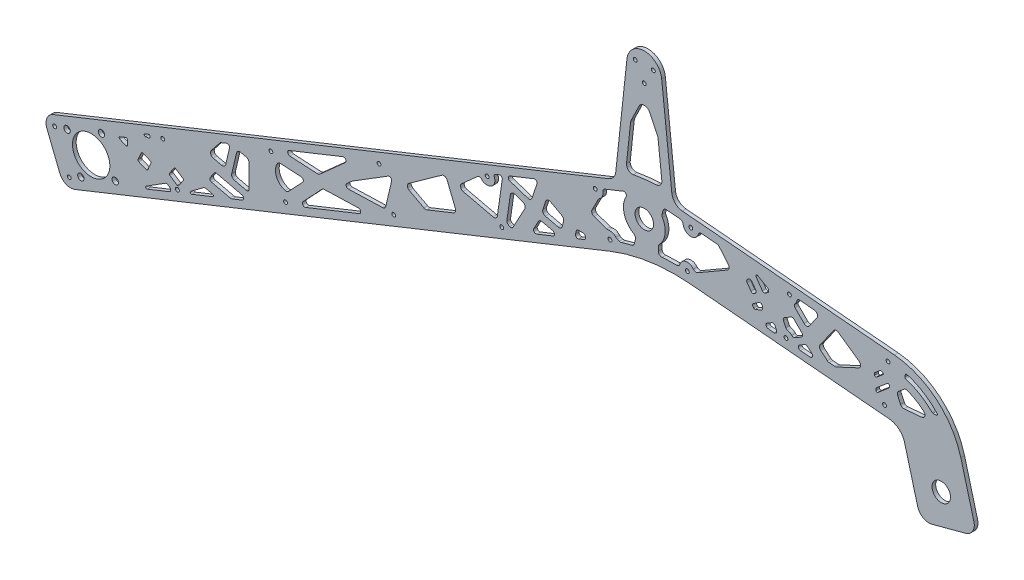
from build123d import *

# Parameters (mm, degrees)
SKETCH1_R                     = 7.9375
BASE_DEPTH                    = 3.175
FILLET1_R                     = 10
SKETCH2_R                     = 1.65
DIFFERENTIAL_ATTACHMENT_DEPTH = 561.184240235
SKETCH3_R                     = 1.65
STRUT_HOLES_DEPTH             = 561.184240235
LIGHTENING_HOLES_DEPTH        = 561.184240235
SKETCH4_R                     = 16.05
SKETCH4_R_2                   = 2.75
MOTOR_CONNECTION_DEPTH        = 561.184240235


with BuildPart() as part:
    # Sketch1 → Base (new body)
    with BuildSketch(Plane.XY):
        with BuildLine():
            Line((-25.142679348, 16.868752297), (-516.78145109, -179.7867564))
            Line((-516.78145109, -179.7867564), (-498.211917272, -226.210590945))
            Line((-498.211917272, -226.210590945), (-29.426356063, -38.696366461))
            ThreePointArc((-29.426356063, -38.696366461), (4.367965887, -29.577289686), (39.355606802, -28.53866538))
            Line((39.355606802, -28.53866538), (210.331723225, -43.497137301))
            ThreePointArc((210.331723225, -43.497137301), (218.666201229, -46.949391125), (223.513274478, -54.557772095))
            Line((223.513274478, -54.557772095), (237.32233047, -106.093870663))
            Line((237.32233047, -106.093870663), (285.618621785, -93.152918408))
            Line((285.618621785, -93.152918408), (271.809565792, -41.61681984))
            ThreePointArc((271.809565792, -41.61681984), (250.805581713, -8.647168969), (214.689510362, 6.312597604))
            Line((214.689510362, 6.312597604), (24.485725965, 22.953272498))
            Line((24.485725965, 22.953272498), (14.913323643, 111.610210516))
            ThreePointArc((14.913323643, 111.610210516), (0, 125), (-14.913323643, 111.610210516))
            Line((-14.913323643, 111.610210516), (-25.142679348, 16.868752297))
        make_face()
        Circle(SKETCH1_R, mode=Mode.SUBTRACT)
        with Locations((255, -75.475248879)):
            Circle(SKETCH1_R, mode=Mode.SUBTRACT)
    extrude(amount=BASE_DEPTH)

    # Fillet1
    fillet1_edges = [part.edges().sort_by_distance(p)[0] for p in [
        (24.485725965, 22.953272498, 1.5875),
        (-25.142679348, 16.868752297, 1.5875),
        (237.32233047, -106.093870663, 1.5875),
        (285.618621785, -93.152918408, 1.5875),
        (-498.211917272, -226.210590945, 1.5875),
        (-516.78145109, -179.7867564, 1.5875),
    ]]
    fillet(fillet1_edges, radius=FILLET1_R)

    # Sketch2 → Differential Attachment (cut, through all)
    with BuildSketch(Plane.XY.offset(3.175)):
        with Locations((-7.794228634, 114.5)):
            Circle(SKETCH2_R)
        with Locations((7.794228634, 114.5)):
            Circle(SKETCH2_R)
        with Locations((0, 101)):
            Circle(SKETCH2_R)
    extrude(amount=-DIFFERENTIAL_ATTACHMENT_DEPTH, mode=Mode.SUBTRACT)

    # Sketch3 → Strut Holes (cut, through all)
    with BuildSketch(Plane.XY.offset(3.175)):
        with Locations((-506.382512152, -184.243444517)):
            Circle(SKETCH3_R)
        with Locations((-493.755229156, -215.811652007)):
            Circle(SKETCH3_R)
        with Locations((-400.907560067, -178.672584371)):
            Circle(SKETCH3_R)
        with Locations((-413.534843063, -147.104376881)):
            Circle(SKETCH3_R)
        with Locations((-308.059890979, -141.533516736)):
            Circle(SKETCH3_R)
        with Locations((-320.687173975, -109.965309246)):
            Circle(SKETCH3_R)
        with Locations((-215.21222189, -104.3944491)):
            Circle(SKETCH3_R)
        with Locations((-227.839504886, -72.82624161)):
            Circle(SKETCH3_R)
        with Locations((-122.364552802, -67.255381465)):
            Circle(SKETCH3_R)
        with Locations((-134.991835798, -35.687173975)):
            Circle(SKETCH3_R)
        with Locations((-29.516883713, -30.11631383)):
            Circle(SKETCH3_R)
        with Locations((-42.144166709, 1.451893661)):
            Circle(SKETCH3_R)
        with Locations((39.925455205, 13.571912522)):
            Circle(SKETCH3_R)
        with Locations((36.962159952, -20.298707213)):
            Circle(SKETCH3_R)
        with Locations((124.602004543, 6.163674388)):
            Circle(SKETCH3_R)
        with Locations((121.638709289, -27.706945347)):
            Circle(SKETCH3_R)
        with Locations((209.278553881, -1.244563745)):
            Circle(SKETCH3_R)
        with Locations((206.315258627, -35.115183481)):
            Circle(SKETCH3_R)
    extrude(amount=-STRUT_HOLES_DEPTH, mode=Mode.SUBTRACT)

    # Sketch6 → Lightening Holes (cut, through all)
    with BuildSketch(Plane.XY.offset(3.175)):
        with BuildLine():
            Line((-426.796734339, -191.182320003), (-407.986767689, -183.658333343))
            ThreePointArc((-407.986767689, -183.658333343), (-406.739433015, -181.999970503), (-407.634463764, -180.127824394))
            Line((-407.634463764, -180.127824394), (-409.200890424, -179.102838545))
            ThreePointArc((-409.200890424, -179.102838545), (-410.2800469, -178.776457544), (-411.364265165, -179.085608015))
            Line((-411.364265165, -179.085608015), (-427.702269747, -189.408450264))
            ThreePointArc((-427.702269747, -189.408450264), (-428.058785266, -190.70851277), (-426.796734339, -191.182320003))
        make_face()
        with BuildLine():
            Line((-423.651842633, -170.222314364), (-426.409277723, -176.656329574))
            ThreePointArc((-426.409277723, -176.656329574), (-426.957032077, -177.190886966), (-427.722342052, -177.181555305))
            Line((-427.722342052, -177.181555305), (-434.156357262, -174.424120215))
            ThreePointArc((-434.156357262, -174.424120215), (-434.690914654, -173.876365862), (-434.681582993, -173.111055887))
            Line((-434.681582993, -173.111055887), (-431.924147903, -166.677040677))
            ThreePointArc((-431.924147903, -166.677040677), (-431.37639355, -166.142483284), (-430.611083575, -166.151814945))
            Line((-430.611083575, -166.151814945), (-424.177068365, -168.909250035))
            ThreePointArc((-424.177068365, -168.909250035), (-423.642510972, -169.457004389), (-423.651842633, -170.222314364))
        make_face()
        with BuildLine():
            Line((-450.38490391, -165.837077415), (-445.265957821, -168.030911453))
            ThreePointArc((-445.265957821, -168.030911453), (-444.321547514, -167.946607515), (-443.872038522, -167.111766423))
            Line((-443.872038522, -167.111766423), (-443.872038522, -162.870353949))
            ThreePointArc((-443.872038522, -162.870353949), (-444.311409713, -162.042286719), (-445.243429199, -161.941877258))
            Line((-445.243429199, -161.941877258), (-450.362375288, -163.989455694))
            ThreePointArc((-450.362375288, -163.989455694), (-450.990910282, -164.905739982), (-450.38490391, -165.837077415))
        make_face()
        with BuildLine():
            Line((-425.780517181, -149.848580605), (-428.852574473, -151.077403522))
            ThreePointArc((-428.852574473, -151.077403522), (-429.442810259, -152.280242286), (-428.306734822, -152.990546428))
            Line((-428.306734822, -152.990546428), (-425.23467753, -152.446283573))
            ThreePointArc((-425.23467753, -152.446283573), (-424.642820764, -152.104093437), (-424.409126505, -151.461617358))
            Line((-424.409126505, -151.461617358), (-424.409126505, -150.777057296))
            ThreePointArc((-424.409126505, -150.777057296), (-424.848497695, -149.948990066), (-425.780517181, -149.848580605))
        make_face()
        with BuildLine():
            Line((-403.882071473, -164.059752929), (-407.714869944, -169.917197413))
            ThreePointArc((-407.714869944, -169.917197413), (-407.856954518, -170.669260184), (-407.425634799, -171.301517835))
            Line((-407.425634799, -171.301517835), (-401.149801424, -175.408087626))
            ThreePointArc((-401.149801424, -175.408087626), (-400.397738653, -175.5501722), (-399.765481002, -175.118852481))
            Line((-399.765481002, -175.118852481), (-395.932682531, -169.261407998))
            ThreePointArc((-395.932682531, -169.261407998), (-395.790597956, -168.509345227), (-396.221917675, -167.877087576))
            Line((-396.221917675, -167.877087576), (-402.49775105, -163.770517785))
            ThreePointArc((-402.49775105, -163.770517785), (-403.249813821, -163.62843321), (-403.882071473, -164.059752929))
        make_face()
        with BuildLine():
            Line((-388.546584225, -175.882259957), (-370.689515989, -168.739432663))
            ThreePointArc((-370.689515989, -168.739432663), (-370.063723376, -167.735952714), (-370.832579745, -166.837371452))
            Line((-370.832579745, -166.837371452), (-376.250977028, -165.566638468))
            ThreePointArc((-376.250977028, -165.566638468), (-377.549518184, -165.550804955), (-378.733087677, -166.085242124))
            Line((-378.733087677, -166.085242124), (-389.517018198, -174.153066632))
            ThreePointArc((-389.517018198, -174.153066632), (-389.790032134, -175.443187171), (-388.546584225, -175.882259957))
        make_face()
        with BuildLine():
            Line((-371.485611267, -158.467163721), (-355.71567651, -162.165559243))
            ThreePointArc((-355.71567651, -162.165559243), (-354.805685977, -162.236355549), (-353.916523721, -162.030235756))
            Line((-353.916523721, -162.030235756), (-345.306147884, -158.586085421))
            ThreePointArc((-345.306147884, -158.586085421), (-344.054562659, -156.579125523), (-345.592275397, -154.781962999))
            Line((-345.592275397, -154.781962999), (-367.367548707, -149.675183894))
            ThreePointArc((-367.367548707, -149.675183894), (-368.566983899, -149.765399553), (-369.497758113, -150.527267657))
            Line((-369.497758113, -150.527267657), (-372.702512994, -155.424909404))
            ThreePointArc((-372.702512994, -155.424909404), (-372.885910809, -157.262776034), (-371.485611267, -158.467163721))
        make_face()
        with BuildLine():
            Line((-352.07324295, -147.099240847), (-341.873298029, -149.491351607))
            ThreePointArc((-341.873298029, -149.491351607), (-340.17432935, -149.111554201), (-339.41664419, -147.544182567))
            Line((-339.41664419, -147.544182567), (-339.41664419, -127.794149032))
            ThreePointArc((-339.41664419, -127.794149032), (-340.065586739, -125.930676773), (-341.73166343, -124.873395472))
            Line((-341.73166343, -124.873395472), (-346.593396875, -123.733212365))
            ThreePointArc((-346.593396875, -123.733212365), (-348.859307743, -124.104326737), (-350.199131194, -125.968985166))
            Line((-350.199131194, -125.968985166), (-354.309015751, -143.493506527))
            ThreePointArc((-354.309015751, -143.493506527), (-353.93790138, -145.759417395), (-352.07324295, -147.099240847))
        make_face()
        with BuildLine():
            Line((-371.842261493, -134.99792488), (-364.617308191, -125.816182178))
            ThreePointArc((-364.617308191, -125.816182178), (-364.056821763, -125.269199463), (-363.373863902, -124.885919294))
            Line((-363.373863902, -124.885919294), (-358.922926706, -123.105544415))
            ThreePointArc((-358.922926706, -123.105544415), (-356.875985846, -123.446197041), (-356.232976313, -125.419151637))
            Line((-356.232976313, -125.419151637), (-359.465542112, -139.202791448))
            ThreePointArc((-359.465542112, -139.202791448), (-360.805365564, -141.067449877), (-363.071276432, -141.438564249))
            Line((-363.071276432, -141.438564249), (-370.169625935, -139.773845629))
            ThreePointArc((-370.169625935, -139.773845629), (-372.316023637, -137.8447049), (-371.842261493, -134.99792488))
        make_face()
        with BuildLine():
            Line((-312.403130248, -114.941050155), (-294.705744126, -115.930050931))
            ThreePointArc((-294.705744126, -115.930050931), (-292.96038463, -117.184153852), (-293.359367078, -119.295993551))
            Line((-293.359367078, -119.295993551), (-305.492646149, -132.217260403))
            ThreePointArc((-305.492646149, -132.217260403), (-306.88286999, -133.05594141), (-308.506457521, -133.047474344))
            ThreePointArc((-308.506457521, -133.047474344), (-315.905519017, -126.362207607), (-315.158106718, -116.418351352))
            ThreePointArc((-315.158106718, -116.418351352), (-313.988244759, -115.292504489), (-312.403130248, -114.941050155))
        make_face()
        with BuildLine():
            Line((-304.334210889, -105.376370731), (-280.776758356, -106.692855474))
            ThreePointArc((-280.776758356, -106.692855474), (-279.617754695, -106.528907524), (-278.6097151, -105.93390787))
            Line((-278.6097151, -105.93390787), (-256.803628387, -86.436050863))
            ThreePointArc((-256.803628387, -86.436050863), (-256.436970546, -83.891178252), (-258.879511357, -83.088178276))
            Line((-258.879511357, -83.088178276), (-304.965398355, -101.522533075))
            ThreePointArc((-304.965398355, -101.522533075), (-306.196320484, -103.702742653), (-304.334210889, -105.376370731))
        make_face()
        with BuildLine():
            Line((-274.809730155, -115.433870232), (-245.572317703, -114.514327573))
            ThreePointArc((-245.572317703, -114.514327573), (-243.551722293, -116.104298884), (-244.766665656, -118.37029253))
            Line((-244.766665656, -118.37029253), (-290.852552654, -136.804647329))
            ThreePointArc((-290.852552654, -136.804647329), (-293.24750287, -136.074786689), (-293.053304941, -133.578635601))
            Line((-293.053304941, -133.578635601), (-276.902380515, -116.378800075))
            ThreePointArc((-276.902380515, -116.378800075), (-275.950034451, -115.698208135), (-274.809730155, -115.433870232))
        make_face()
        with BuildLine():
            Line((-255.407169534, -101.284862499), (-251.12632954, -97.4571603))
            ThreePointArc((-251.12632954, -97.4571603), (-250.923807003, -97.291389204), (-250.707607222, -97.143899919))
            Line((-250.707607222, -97.143899919), (-219.985538048, -78.094363666))
            ThreePointArc((-219.985538048, -78.094363666), (-217.764542175, -78.169927362), (-216.984415603, -80.250776965))
            Line((-216.984415603, -80.250776965), (-221.977832162, -101.54267311))
            ThreePointArc((-221.977832162, -101.54267311), (-222.998385995, -103.179166235), (-224.80427968, -103.856209712))
            Line((-224.80427968, -103.856209712), (-254.011197222, -104.774793279))
            ThreePointArc((-254.011197222, -104.774793279), (-255.931021298, -103.518563057), (-255.407169534, -101.284862499))
        make_face()
        with BuildLine():
            Line((-201.795892517, -79.64790479), (-189.230112404, -86.385218982))
            ThreePointArc((-189.230112404, -86.385218982), (-187.97991598, -86.736600163), (-186.698353122, -86.526703824))
            Line((-186.698353122, -86.526703824), (-163.856826533, -77.390093189))
            ThreePointArc((-163.856826533, -77.390093189), (-162.213563472, -75.786421012), (-162.185568489, -73.490491087))
            Line((-162.185568489, -73.490491087), (-169.308143639, -55.684053213))
            ThreePointArc((-169.308143639, -55.684053213), (-171.250122457, -53.919234103), (-173.837422852, -54.357120948))
            Line((-173.837422852, -54.357120948), (-202.122154404, -74.562855266))
            ThreePointArc((-202.122154404, -74.562855266), (-203.372149312, -77.196047603), (-201.795892517, -79.64790479))
        make_face()
        with BuildLine():
            Line((-155.514752487, -57.319281226), (-129.85708805, -63.336566188))
            ThreePointArc((-129.85708805, -63.336566188), (-127.481468178, -62.894065922), (-126.202768073, -60.843626382))
            Line((-126.202768073, -60.843626382), (-121.983812097, -31.560997456))
            ThreePointArc((-121.983812097, -31.560997456), (-122.72659345, -29.704044074), (-124.706152928, -29.418834904))
            Line((-124.706152928, -29.418834904), (-127.703293774, -30.617691243))
            ThreePointArc((-127.703293774, -30.617691243), (-128.798802482, -31.686806027), (-128.817465803, -33.217425977))
            ThreePointArc((-128.817465803, -33.217425977), (-131.577547319, -41.393760887), (-140.087276159, -39.960227628))
            ThreePointArc((-140.087276159, -39.960227628), (-141.476478554, -39.250494064), (-142.952841043, -39.754437341))
            Line((-142.952841043, -39.754437341), (-156.829424154, -52.162148858))
            ThreePointArc((-156.829424154, -52.162148858), (-157.736800692, -55.139596218), (-155.514752487, -57.319281226))
        make_face()
        with BuildLine():
            Line((-111.155772426, -37.195951273), (-104.367387645, -39.427673581))
            ThreePointArc((-104.367387645, -39.427673581), (-102.518892219, -41.163440756), (-102.660377062, -43.695200039))
            Line((-102.660377062, -43.695200039), (-112.784189472, -62.577145728))
            ThreePointArc((-112.784189472, -62.577145728), (-113.968708932, -63.546712333), (-115.491877795, -63.394717713))
            Line((-115.491877795, -63.394717713), (-117.038678833, -62.565379264))
            ThreePointArc((-117.038678833, -62.565379264), (-117.878770117, -61.704548107), (-118.073180143, -60.51753994))
            Line((-118.073180143, -60.51753994), (-115.062046291, -39.618076723))
            ThreePointArc((-115.062046291, -39.618076723), (-113.673637182, -37.496251289), (-111.155772426, -37.195951273))
        make_face()
        with BuildLine():
            Line((-115.378266873, -29.491856635), (-100.161047517, -34.494608982))
            ThreePointArc((-100.161047517, -34.494608982), (-97.871414376, -34.322393957), (-96.374173666, -32.581604425))
            Line((-96.374173666, -32.581604425), (-92.226617061, -19.965693366))
            ThreePointArc((-92.226617061, -19.965693366), (-92.757518184, -17.883099333), (-94.869357883, -17.484116886))
            Line((-94.869357883, -17.484116886), (-115.496425128, -25.734943784))
            ThreePointArc((-115.496425128, -25.734943784), (-116.75265535, -27.65476786), (-115.378266873, -29.491856635))
        make_face()
        with BuildLine():
            Line((-84.743582046, -29.223334948), (-87.127831768, -36.475672961))
            ThreePointArc((-87.127831768, -36.475672961), (-86.894064264, -38.880819322), (-84.962873323, -40.333361168))
            Line((-84.962873323, -40.333361168), (-73.980416434, -42.908988144))
            ThreePointArc((-73.980416434, -42.908988144), (-71.714505566, -42.537873773), (-70.374682114, -40.673215344))
            Line((-70.374682114, -40.673215344), (-69.299519286, -36.088727947))
            ThreePointArc((-69.299519286, -36.088727947), (-69.483283729, -34.175378117), (-70.790636015, -32.766297941))
            Line((-70.790636015, -32.766297941), (-80.464006011, -27.522820348))
            ThreePointArc((-80.464006011, -27.522820348), (-83.001456989, -27.372304778), (-84.743582046, -29.223334948))
        make_face()
        with BuildLine():
            Line((-94.901969067, -54.620237741), (-91.010250338, -47.361784234))
            ThreePointArc((-91.010250338, -47.361784234), (-89.600915445, -46.045192029), (-87.681324348, -45.858617928))
            Line((-87.681324348, -45.858617928), (-78.6052556, -47.98715508))
            ThreePointArc((-78.6052556, -47.98715508), (-77.067542862, -49.784317604), (-78.319128087, -51.791277502))
            Line((-78.319128087, -51.791277502), (-92.396557561, -57.422249292))
            ThreePointArc((-92.396557561, -57.422249292), (-94.630258119, -56.898397528), (-94.901969067, -54.620237741))
        make_face()
        with BuildLine():
            Line((-58.494420241, -38.192390679), (-59.084332273, -40.707771798))
            ThreePointArc((-59.084332273, -40.707771798), (-58.44132274, -42.680726393), (-56.39438188, -43.021379019))
            Line((-56.39438188, -43.021379019), (-51.605265919, -41.105732635))
            ThreePointArc((-51.605265919, -41.105732635), (-50.509757212, -40.03661785), (-50.49109389, -38.5059979))
            Line((-50.49109389, -38.5059979), (-50.730987784, -37.906263166))
            ThreePointArc((-50.730987784, -37.906263166), (-51.466683547, -36.992910058), (-52.587941166, -36.649044519))
            Line((-52.587941166, -36.649044519), (-56.5472512, -36.649044519))
            ThreePointArc((-56.5472512, -36.649044519), (-57.78956604, -37.081672884), (-58.494420241, -38.192390679))
        make_face()
        with BuildLine():
            Line((-33.675956212, 5.37769434), (-18.142519918, 11.591068858))
            ThreePointArc((-18.142519918, 11.591068858), (-15.896945391, 11.053817213), (-15.654310246, 8.757652481))
            ThreePointArc((-15.654310246, 8.757652481), (-17.303085915, -4.728332059), (-9.025079892, -15.501672142))
            ThreePointArc((-9.025079892, -15.501672142), (-7.779093722, -16.907807822), (-7.61374736, -18.779267057))
            Line((-7.61374736, -18.779267057), (-8.521342804, -22.649248205))
            ThreePointArc((-8.521342804, -22.649248205), (-9.313466338, -24.078252832), (-10.736968481, -24.880222635))
            ThreePointArc((-10.736968481, -24.880222635), (-15.185825278, -26.024956093), (-19.599405079, -27.298947783))
            ThreePointArc((-19.599405079, -27.298947783), (-20.532558199, -27.428479051), (-21.459871523, -27.262216929))
            Line((-21.459871523, -27.262216929), (-23.182570628, -26.662357147))
            ThreePointArc((-23.182570628, -26.662357147), (-23.885379996, -26.308343068), (-24.471950227, -25.783745755))
            ThreePointArc((-24.471950227, -25.783745755), (-27.330075005, -23.83615717), (-30.779721267, -23.587321464))
            ThreePointArc((-30.779721267, -23.587321464), (-31.565262673, -23.634136797), (-32.335952663, -23.475064754))
            Line((-32.335952663, -23.475064754), (-43.164664403, -19.704407044))
            ThreePointArc((-43.164664403, -19.704407044), (-44.963564231, -17.985425692), (-44.846417011, -15.500025522))
            Line((-44.846417011, -15.500025522), (-39.60538969, -5.301472187))
            ThreePointArc((-39.60538969, -5.301472187), (-39.157008692, -4.654771749), (-38.555881927, -4.146919814))
            ThreePointArc((-38.555881927, -4.146919814), (-36.130963451, -1.387804664), (-35.540763207, 2.237744908))
            ThreePointArc((-35.540763207, 2.237744908), (-35.141181786, 4.124161133), (-33.675956212, 5.37769434))
        make_face()
        with BuildLine():
            Line((-4.495602513, 81.765187334), (-11.301594192, 67.784401002))
            ThreePointArc((-11.301594192, 67.784401002), (-11.610857617, 66.97910273), (-11.777099561, 66.132631946))
            Line((-11.777099561, 66.132631946), (-15.278404446, 33.704516223))
            ThreePointArc((-15.278404446, 33.704516223), (-13.714730282, 29.508627097), (-9.418217615, 28.24746043))
            ThreePointArc((-9.418217615, 28.24746043), (0.418255708, 29.713671709), (10.32632918, 30.571612869))
            ThreePointArc((10.32632918, 30.571612869), (13.860424349, 32.328173032), (15.019693041, 36.100629574))
            Line((15.019693041, 36.100629574), (11.777099561, 66.132631946))
            ThreePointArc((11.777099561, 66.132631946), (11.610857617, 66.97910273), (11.301594192, 67.784401002))
            Line((11.301594192, 67.784401002), (4.495602513, 81.765187334))
            ThreePointArc((4.495602513, 81.765187334), (0, 84.57668144), (-4.495602513, 81.765187334))
        make_face()
        with BuildLine():
            Line((15.235584749, 11.11217048), (15.934572794, 14.09265102))
            ThreePointArc((15.934572794, 14.09265102), (17.096179394, 15.837773544), (19.116793583, 16.396254354))
            Line((19.116793583, 16.396254354), (30.608063405, 15.390898515))
            ThreePointArc((30.608063405, 15.390898515), (32.431296753, 14.559633013), (33.324479812, 12.765920048))
            ThreePointArc((33.324479812, 12.765920048), (39.345869516, 6.947217779), (46.286187825, 11.631917537))
            ThreePointArc((46.286187825, 11.631917537), (47.477276414, 13.243280361), (49.41715849, 13.745315924))
            Line((49.41715849, 13.745315924), (63.497285407, 12.513464438))
            Line((63.497285407, 12.513464438), (72.126541442, 2.229517557))
            ThreePointArc((72.126541442, 2.229517557), (72.782831372, -0.219789806), (71.328408113, -2.296921484))
            Line((71.328408113, -2.296921484), (46.026573051, -16.904942768))
            ThreePointArc((46.026573051, -16.904942768), (43.963993637, -17.253645205), (42.174942036, -16.169614947))
            ThreePointArc((42.174942036, -16.169614947), (35.729461615, -13.763957424), (30.603340014, -18.352452091))
            ThreePointArc((30.603340014, -18.352452091), (29.50786026, -19.8943391), (27.707550767, -20.474319418))
            ThreePointArc((27.707550767, -20.474319418), (21.45541347, -20.541850346), (15.210883091, -20.857479168))
            ThreePointArc((15.210883091, -20.857479168), (12.954596528, -20.059512933), (12, -17.864900293))
            Line((12, -17.864900293), (12, -14.607494866))
            ThreePointArc((12, -14.607494866), (12.220812961, -13.477840315), (12.850746269, -12.514480676))
            ThreePointArc((12.850746269, -12.514480676), (17.796611836, -2.243772136), (15.554833118, 8.933144626))
            ThreePointArc((15.554833118, 8.933144626), (15.188026694, 9.992303351), (15.235584749, 11.11217048))
        make_face()
        with BuildLine():
            Line((139.955994367, -24.743189886), (143.843308726, -28.005033932))
            ThreePointArc((143.843308726, -28.005033932), (144.405492572, -30.302489683), (142.383422021, -31.529512214))
            Line((142.383422021, -31.529512214), (134.101437068, -30.804932419))
            ThreePointArc((134.101437068, -30.804932419), (132.323156539, -29.245422251), (133.275748553, -27.080492216))
            Line((133.275748553, -27.080492216), (137.670419147, -24.543227965))
            ThreePointArc((137.670419147, -24.543227965), (138.844730633, -24.282889377), (139.955994367, -24.743189886))
        make_face()
        with BuildLine():
            Line((112.237632277, -23.281511162), (113.501173169, -25.99118335))
            ThreePointArc((113.501173169, -25.99118335), (113.326861684, -27.983572746), (111.51424611, -28.82880927))
            Line((111.51424611, -28.82880927), (106.341297154, -28.376234879))
            ThreePointArc((106.341297154, -28.376234879), (104.563016626, -26.816724711), (105.51560864, -24.651794675))
            Line((105.51560864, -24.651794675), (109.425016703, -22.394696878))
            ThreePointArc((109.425016703, -22.394696878), (111.026428302, -22.219313784), (112.237632277, -23.281511162))
        make_face()
        with BuildLine():
            Line((121.475544827, -20.060903343), (119.474003183, -15.768583436))
            ThreePointArc((119.474003183, -15.768583436), (119.379184855, -14.321935314), (120.286618757, -13.191296105))
            Line((120.286618757, -13.191296105), (126.030691316, -9.874954267))
            ThreePointArc((126.030691316, -9.874954267), (127.2917437, -9.624115352), (128.444904878, -10.192791512))
            Line((128.444904878, -10.192791512), (135.416196584, -17.164083219))
            ThreePointArc((135.416196584, -17.164083219), (135.984872745, -18.839349165), (135.001983022, -20.310347589))
            Line((135.001983022, -20.310347589), (129.117533249, -23.707736249))
            ThreePointArc((129.117533249, -23.707736249), (127.795986644, -23.949668162), (126.61953927, -23.30083224))
            ThreePointArc((126.61953927, -23.30083224), (124.938372986, -21.933322612), (122.906784421, -21.178968213))
            ThreePointArc((122.906784421, -21.178968213), (122.05693459, -20.791764216), (121.475544827, -20.060903343))
        make_face()
        with BuildLine():
            Line((129.410503778, -1.258895475), (137.162798971, -9.011190669))
            ThreePointArc((137.162798971, -9.011190669), (139.545586543, -9.87845442), (141.741575448, -8.610599635))
            Line((141.741575448, -8.610599635), (148.18202825, 0.587320197))
            ThreePointArc((148.18202825, 0.587320197), (148.443495478, 3.575904291), (145.986039345, 5.2966336))
            Line((145.986039345, 5.2966336), (133.248467219, 6.411026762))
            ThreePointArc((133.248467219, 6.411026762), (131.879446129, 6.02259153), (131.115276845, 4.822114134))
            ThreePointArc((131.115276845, 4.822114134), (130.483531435, 3.060427473), (129.385939815, 1.544533417))
            ThreePointArc((129.385939815, 1.544533417), (128.82479411, 0.137794532), (129.410503778, -1.258895475))
        make_face()
        with BuildLine():
            Line((151.537502777, -22.059860074), (157.132026021, -26.754222464))
            ThreePointArc((157.132026021, -26.754222464), (157.912338553, -27.227727732), (158.798921622, -27.444673229))
            Line((158.798921622, -27.444673229), (163.432939368, -27.850097248))
            ThreePointArc((163.432939368, -27.850097248), (164.215351129, -27.815936413), (164.962261382, -27.580436515))
            Line((164.962261382, -27.580436515), (183.994724909, -18.705453019))
            ThreePointArc((183.994724909, -18.705453019), (185.715454219, -16.247996886), (184.447599433, -13.529073525))
            Line((184.447599433, -13.529073525), (166.586933117, -1.022900332))
            ThreePointArc((166.586933117, -1.022900332), (164.345259275, -0.525933206), (162.408747675, -1.759627156))
            Line((162.408747675, -1.759627156), (151.008409473, -18.040997435))
            ThreePointArc((151.008409473, -18.040997435), (150.491531022, -20.153305321), (151.537502777, -22.059860074))
        make_face()
        with BuildLine():
            Line((88.930720251, -0.217125601), (89.78351335, 0.275234724))
            ThreePointArc((89.78351335, 0.275234724), (91.216392578, 0.495775931), (92.421817438, -0.309663211))
            Line((92.421817438, -0.309663211), (95.672468772, -4.952074434))
            ThreePointArc((95.672468772, -4.952074434), (96.00378019, -6.446523662), (95.181317556, -7.737531396))
            Line((95.181317556, -7.737531396), (94.377751116, -8.300194674))
            ThreePointArc((94.377751116, -8.300194674), (92.883301888, -8.631506092), (91.592294155, -7.809043458))
            Line((91.592294155, -7.809043458), (88.292416163, -3.096329281))
            ThreePointArc((88.292416163, -3.096329281), (87.978128237, -1.516297181), (88.930720251, -0.217125601))
        make_face()
        with BuildLine():
            Line((95.883206716, 5.207641366), (101.326040716, -2.565531163))
            ThreePointArc((101.326040716, -2.565531163), (102.617048449, -3.387993796), (104.111497677, -3.056682378))
            Line((104.111497677, -3.056682378), (106.013201233, -1.725095213))
            ThreePointArc((106.013201233, -1.725095213), (106.864144803, 0.00044765), (105.86604836, 1.645259683))
            Line((105.86604836, 1.645259683), (97.20235876, 6.647243206))
            ThreePointArc((97.20235876, 6.647243206), (95.965081423, 6.456808009), (95.883206716, 5.207641366))
        make_face()
        with BuildLine():
            Line((100.12853391, -17.783059001), (95.162390172, -19.590587501))
            ThreePointArc((95.162390172, -19.590587501), (94.519664229, -19.604611831), (94.001217984, -19.224471317))
            Line((94.001217984, -19.224471317), (93.007397573, -17.805148677))
            ThreePointArc((93.007397573, -17.805148677), (92.841741864, -17.057924063), (93.252973181, -16.412420196))
            Line((93.252973181, -16.412420196), (98.297340751, -12.880315998))
            ThreePointArc((98.297340751, -12.880315998), (100.36799085, -12.74459842), (101.444493624, -14.518620087))
            Line((101.444493624, -14.518620087), (101.444493624, -15.90367376))
            ThreePointArc((101.444493624, -15.90367376), (101.082797712, -17.050826632), (100.12853391, -17.783059001))
        make_face()
        with BuildLine():
            Line((222.951399905, -15.097959442), (218.381529175, -18.932536286))
            ThreePointArc((218.381529175, -18.932536286), (217.381003983, -20.581350774), (217.590968643, -22.498524401))
            Line((217.590968643, -22.498524401), (220.112115871, -27.905142079))
            ThreePointArc((220.112115871, -27.905142079), (221.331039232, -29.235363505), (223.09250646, -29.625871388))
            Line((223.09250646, -29.625871388), (238.243025822, -28.300372698))
            ThreePointArc((238.243025822, -28.300372698), (240.833459693, -26.242734426), (239.955911197, -23.053042978))
            ThreePointArc((239.955911197, -23.053042978), (233.328884018, -18.212064673), (225.960811074, -14.597640612))
            ThreePointArc((225.960811074, -14.597640612), (224.387761521, -14.436711957), (222.951399905, -15.097959442))
        make_face()
        with BuildLine():
            Line((224.214913471, -3.510576543), (223.681745459, -5.43853095))
            ThreePointArc((223.681745459, -5.43853095), (223.77112299, -6.19019545), (224.361547418, -6.66389035))
            ThreePointArc((224.361547418, -6.66389035), (236.642672413, -12.037144981), (247.221826291, -20.269969509))
            ThreePointArc((247.221826291, -20.269969509), (247.546337407, -20.486927012), (247.929186277, -20.563116023))
            Line((247.929186277, -20.563116023), (250.708717476, -20.563116023))
            ThreePointArc((250.708717476, -20.563116023), (251.625792067, -19.961831705), (251.440021518, -18.881064413))
            ThreePointArc((251.440021518, -18.881064413), (239.52742049, -9.108881493), (225.462146564, -2.818119085))
            ThreePointArc((225.462146564, -2.818119085), (224.693334952, -2.902826925), (224.214913471, -3.510576543))
        make_face()
        with BuildLine():
            Line((198.904547495, -26.604121063), (198.904547495, -27.909528352))
            ThreePointArc((198.904547495, -27.909528352), (199.481929233, -28.815836139), (200.547335105, -28.675572796))
            Line((200.547335105, -28.675572796), (210.038001752, -20.711957913))
            ThreePointArc((210.038001752, -20.711957913), (210.301521929, -20.368531731), (210.395214142, -19.945913469))
            Line((210.395214142, -19.945913469), (210.395214142, -18.64050618))
            ThreePointArc((210.395214142, -18.64050618), (209.817832404, -17.734198393), (208.752426532, -17.874461737))
            Line((208.752426532, -17.874461737), (199.261759885, -25.83807662))
            ThreePointArc((199.261759885, -25.83807662), (198.998239708, -26.181502801), (198.904547495, -26.604121063))
        make_face()
        with BuildLine():
            Line((204.895700874, -13.278195078), (199.371764998, -17.913327635))
            ThreePointArc((199.371764998, -17.913327635), (198.306359126, -18.053590979), (197.728977388, -17.147283192))
            Line((197.728977388, -17.147283192), (197.728977388, -15.841875902))
            ThreePointArc((197.728977388, -15.841875902), (197.822669601, -15.419257641), (198.086189778, -15.075831459))
            Line((198.086189778, -15.075831459), (202.324550435, -11.519424595))
            ThreePointArc((202.324550435, -11.519424595), (202.708519, -11.319543212), (203.140986223, -11.300661285))
            Line((203.140986223, -11.300661285), (204.426561442, -11.527342882))
            ThreePointArc((204.426561442, -11.527342882), (205.218839091, -12.25333159), (204.895700874, -13.278195078))
        make_face()
    extrude(amount=-LIGHTENING_HOLES_DEPTH, mode=Mode.SUBTRACT)

    # Sketch4 → Motor Connection (cut, through all)
    with BuildSketch(Plane.XY.offset(3.175)):
        with Locations((-475, -190)):
            Circle(SKETCH4_R)
        with Locations((-466.136815782, -169.319236825)):
            Circle(SKETCH4_R_2)
        with Locations((-454.319236825, -198.863184218)):
            Circle(SKETCH4_R_2)
        with Locations((-483.863184218, -210.680763175)):
            Circle(SKETCH4_R_2)
        with Locations((-495.680763175, -181.136815782)):
            Circle(SKETCH4_R_2)
    extrude(amount=-MOTOR_CONNECTION_DEPTH, mode=Mode.SUBTRACT)


solid = part.part
